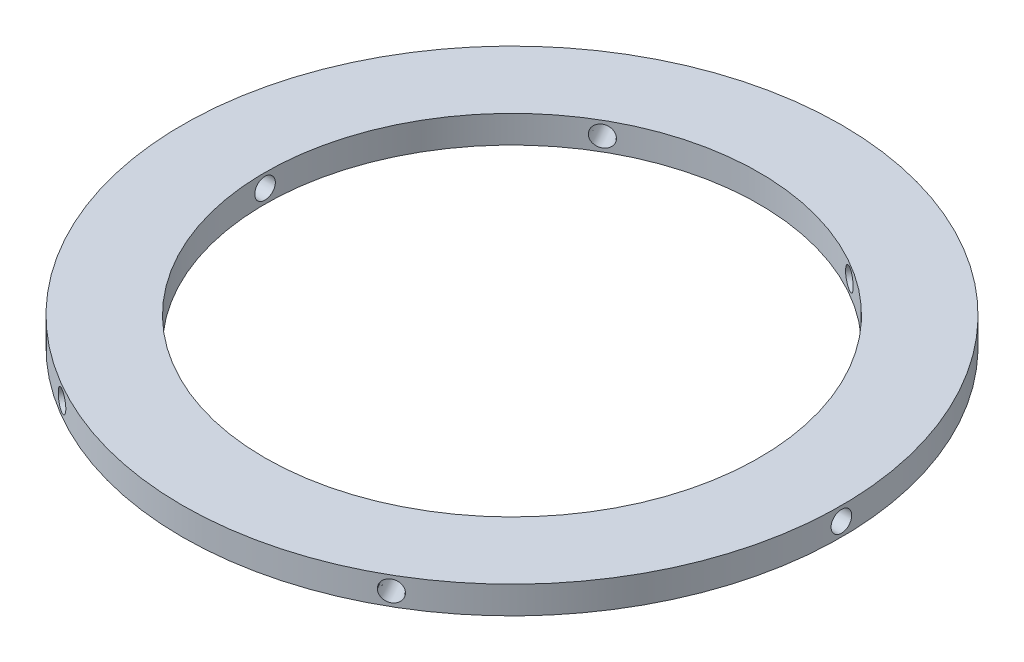
from build123d import *

# Parameters (mm, degrees)
SKETCH1_R           = 76.2
SKETCH1_R_2         = 57.15
BOSS_EXTRUDE1_DEPTH = 6.35
CUT_EXTRUDE1_START  = 57.100368974
CUT_EXTRUDE1_DEPTH  = 19.099631087
CIRPATTERN1_COUNT   = 6


# Read off the part's stored shape, not the designer's step: Cut-Extrude1
with BuildPart() as part:
    # Sketch1 → Boss-Extrude1 (new body)
    with BuildSketch(Plane(origin=(0, 0, -13.767833252), x_dir=(1, 0, 0), z_dir=(0, 1, 0))):
        with Locations(Location((0, -13.767833252, 0), (0, 0, 270))):
            Circle(SKETCH1_R)
        with Locations(Location((0, -13.767833252, 0), (0, 0, 270))):
            Circle(SKETCH1_R_2, mode=Mode.SUBTRACT)
    extrude(amount=BOSS_EXTRUDE1_DEPTH)

    # Cut-Extrude1 outline → Cut-Extrude1 (cut)
    with BuildSketch(Plane(origin=(0, 0, 0), x_dir=(0, 0, -1), z_dir=(1, 0, 0)).offset(CUT_EXTRUDE1_START)):
        with BuildLine():
            add(Edge.make_bspline(
                [(-2.38125, 3.175), (-2.38125, 2.545691165), (-2.12303441, 1.930358503), (-1.2442555, 1.051739344), (-0.622488817, 0.794081133), (0.619952824, 0.793419542), (1.238189901, 1.046043836), (2.127702908, 1.934657743), (2.381029268, 2.552538154), (2.381470433, 3.79577186), (2.124110908, 4.417631723), (1.246749984, 5.296696308), (0.630583151, 5.555611292), (-0.625750032, 5.556886255), (-1.242453926, 5.299439591), (-2.122454563, 4.420841868), (-2.38125, 3.804308835), (-2.38125, 3.175)],
                knots=[0, 0, 0, 0, 0.125, 0.125, 0.25, 0.25, 0.375, 0.375, 0.5, 0.5, 0.625, 0.625, 0.75, 0.75, 0.875, 0.875, 1, 1, 1, 1], degree=3))
        make_face()
    cut_extrude1 = extrude(amount=CUT_EXTRUDE1_DEPTH, mode=Mode.SUBTRACT)

    # CirPattern1: Cut-Extrude1 ×6 about axis
    cirpattern1_axis = Axis((0, 6.35, 0), (0, 1, 0))
    for i in range(1, CIRPATTERN1_COUNT):
        add(cut_extrude1.rotate(cirpattern1_axis, i * 360 / CIRPATTERN1_COUNT), mode=Mode.SUBTRACT)


solid = part.part
